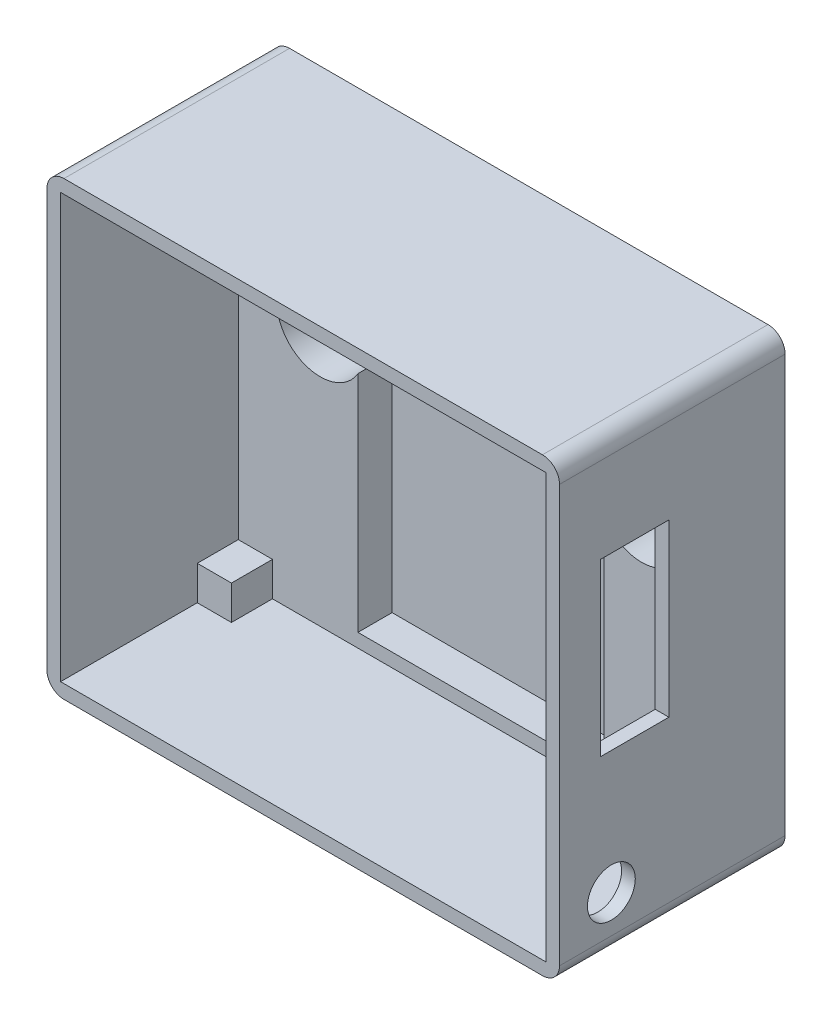
from build123d import *

# Parameters (mm, degrees)
SKETCH1_W               = 75
SKETCH1_H               = 66
BOSS_EXTRUDE1_DEPTH     = 38
SKETCH2_W               = 71
SKETCH2_H               = 62
CUT_EXTRUDE1_DEPTH      = 31
CUT_EXTRUDE2_DEPTH      = 4
CUT_EXTRUDE2_DEPTH_BACK = 5
SKETCH3_W               = 36
SKETCH3_H               = 45
SKETCH4_R               = 6.375
CUT_EXTRUDE5_DEPTH      = 16
SKETCH6_R               = 3
CUT_EXTRUDE7_DEPTH      = 5
SKETCH7_W               = 10
SKETCH7_H               = 25
CUT_EXTRUDE8_DEPTH      = 5
SKETCH8_R               = 3.5
CUT_EXTRUDE9_DEPTH      = 5
SKETCH9_W               = 5
SKETCH9_H               = 5
BOSS_EXTRUDE2_DEPTH     = 6
SKETCH10_W              = 5
SKETCH10_H              = 66
CUT_EXTRUDE10_DEPTH     = 76
FILLET3_R               = 2.5


with BuildPart() as part:
    # Sketch1 → Boss-Extrude1 (new body)
    with BuildSketch(Plane.XY):
        with Locations((37.5, 33)):
            Rectangle(SKETCH1_W, SKETCH1_H)
    extrude(amount=BOSS_EXTRUDE1_DEPTH)

    # Sketch2 → Cut-Extrude1 (cut)
    with BuildSketch(Plane.XY.offset(38)):
        with Locations((37.5, 33)):
            Rectangle(SKETCH2_W, SKETCH2_H)
    extrude(amount=-CUT_EXTRUDE1_DEPTH, mode=Mode.SUBTRACT)

    # Sketch3 → Cut-Extrude2 (cut, two sides: drawn at the far end of the back side and taken through both)
    with BuildSketch(Plane.XY.offset(7).offset(-CUT_EXTRUDE2_DEPTH_BACK)):
        with Locations((37.5, 26.5)):
            Rectangle(SKETCH3_W, SKETCH3_H)
    extrude(amount=CUT_EXTRUDE2_DEPTH + CUT_EXTRUDE2_DEPTH_BACK, mode=Mode.SUBTRACT)

    # Sketch4 → Cut-Extrude5 (cut)
    with BuildSketch(Plane(origin=(0, 0, 0), x_dir=(-1, 0, 0), z_dir=(0, 0, -1))):
        with Locations((-61, 40)):
            Circle(SKETCH4_R)
        with Locations((-14, 40)):
            Circle(SKETCH4_R)
    extrude(amount=-CUT_EXTRUDE5_DEPTH, mode=Mode.SUBTRACT)

    # Sketch6 → Cut-Extrude7 (cut)
    with BuildSketch(Plane.XY.offset(7)):
        with Locations((37.5, 49)):
            Circle(SKETCH6_R)
    extrude(amount=-CUT_EXTRUDE7_DEPTH, mode=Mode.SUBTRACT)

    # Sketch7 → Cut-Extrude8 (cut)
    with BuildSketch(Plane(origin=(75, 0, 0), x_dir=(0, 0, -1), z_dir=(1, 0, 0))):
        with Locations((-22, 38.5)):
            Rectangle(SKETCH7_W, SKETCH7_H)
    extrude(amount=-CUT_EXTRUDE8_DEPTH, mode=Mode.SUBTRACT)

    # Sketch8 → Cut-Extrude9 (cut)
    with BuildSketch(Plane(origin=(75, 0, 0), x_dir=(0, 0, -1), z_dir=(1, 0, 0))):
        with Locations((-25.416851566, 8)):
            Circle(SKETCH8_R)
    extrude(amount=-CUT_EXTRUDE9_DEPTH, mode=Mode.SUBTRACT)

    # Sketch9 → Boss-Extrude2 (add)
    with BuildSketch(Plane.XY.offset(7)):
        with Locations((4.5, 61.5)):
            Rectangle(SKETCH9_W, SKETCH9_H)
        with Locations((70.5, 61.5)):
            Rectangle(SKETCH9_W, SKETCH9_H)
        with Locations((70.5, 4.5)):
            Rectangle(SKETCH9_W, SKETCH9_H)
        with Locations((4.5, 4.5)):
            Rectangle(SKETCH9_W, SKETCH9_H)
    extrude(amount=BOSS_EXTRUDE2_DEPTH)

    # Sketch10 → Cut-Extrude10 (cut)
    with BuildSketch(Plane(origin=(75, 0, 0), x_dir=(0, 0, -1), z_dir=(1, 0, 0))):
        with Locations((-35.5, 33)):
            Rectangle(SKETCH10_W, SKETCH10_H)
    extrude(amount=-CUT_EXTRUDE10_DEPTH, mode=Mode.SUBTRACT)

    # Fillet3
    fillet3_edges = [part.edges().sort_by_distance(p)[0] for p in [
        (0, 66, 16.5),
        (0, 0, 16.5),
        (75, 0, 16.5),
        (75, 66, 16.5),
    ]]
    fillet(fillet3_edges, radius=FILLET3_R)


solid = part.part
